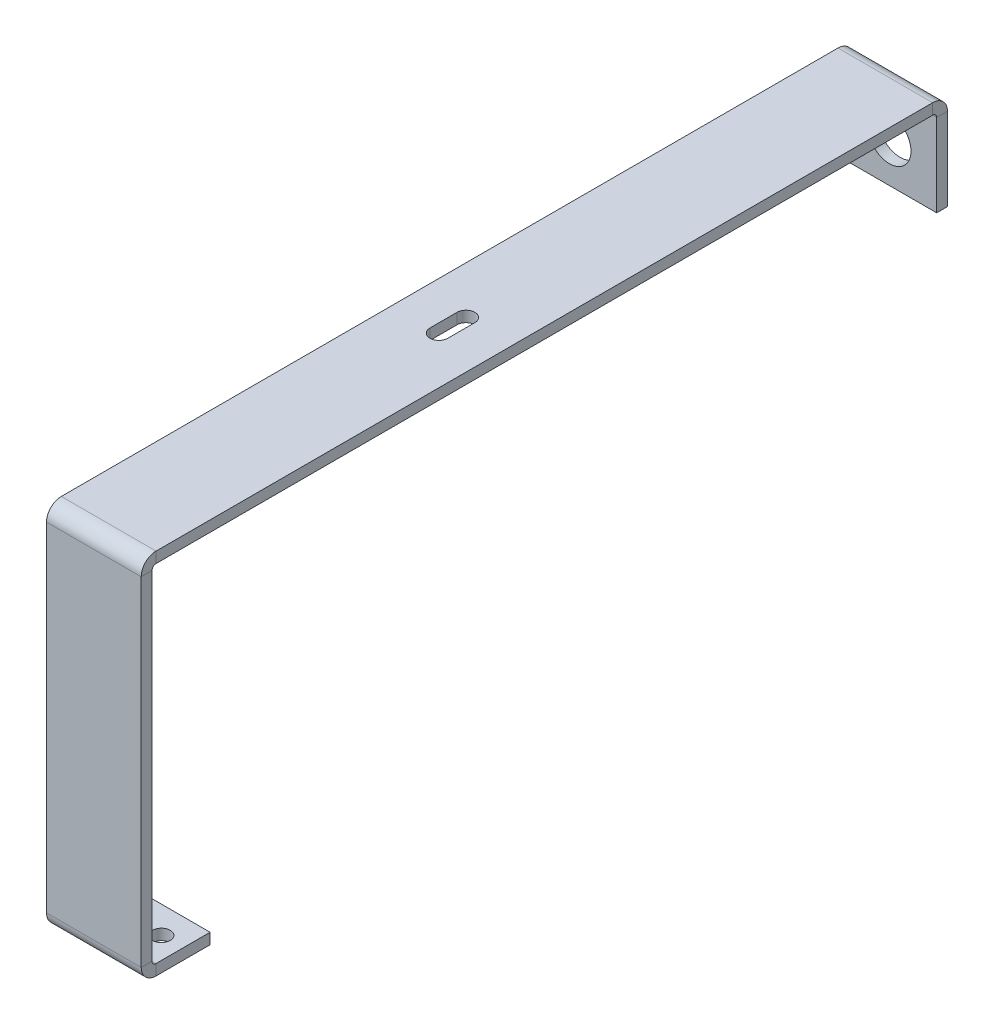
from build123d import *

# Parameters (mm, degrees)
SKETCH1_W                    = 17.5
SKETCH1_H                    = 10
BASE_FLANGE1_DEPTH           = 2
EDGE_FLANGE1_DEPTH           = 17.5
EDGE_FLANGE2_STRIP_W         = 9.4732
EDGE_FLANGE2_STRIP_H         = 2
EDGE_FLANGE2_STRIP_CUT_DEPTH = 17.5
EDGE_FLANGE2_DEPTH           = 17.5
EDGE_FLANGE3_STRIP_W         = 9.4732
EDGE_FLANGE3_STRIP_H         = 2
EDGE_FLANGE3_STRIP_CUT_DEPTH = 17.5
EDGE_FLANGE3_DEPTH           = 17.5
SKETCH18_R                   = 4
CUT_EXTRUDE2_DEPTH           = 2
F_4_CLEARANCE_HOLE1_D        = 3.2639
F_4_CLEARANCE_HOLE1_DEPTH    = 2
F_4_CLEARANCE_HOLE1_TIP      = 0.980574487
CUT_EXTRUDE3_DEPTH           = 2


# Sheet-metal steps are written as plain solids
with BuildPart() as part:
    # Sketch1 → Base-Flange1 (new body)
    with BuildSketch(Plane(origin=(0, 0, 0), x_dir=(1, 0, 0), z_dir=(0, 1, 0))):
        Rectangle(SKETCH1_W, SKETCH1_H)
    extrude(amount=BASE_FLANGE1_DEPTH)

    # Edge-Flange1 section (across the edge) → Edge-Flange1 (add)
    with BuildSketch(Plane(origin=(-8.75, 2, 5.7366), x_dir=(0, 0, -1), z_dir=(1, 0, 0))):
        with BuildLine():
            Line((-2, 0.7366), (-2, 66))
            Line((-2, 66), (0, 66))
            Line((0, 66), (0, 0.7366))
            ThreePointArc((0, 0.7366), (0.215745145, 0.215745145), (0.7366, 0))
            Line((0.7366, 0), (0.7366, -2))
            ThreePointArc((0.7366, -2), (-1.198468417, -1.198468417), (-2, 0.7366))
        make_face()
    extrude(amount=EDGE_FLANGE1_DEPTH)

    # Edge-Flange2 strip (across the edge) → Edge-Flange2 strip cut (cut)
    with BuildSketch(Plane(origin=(-8.75, 68, 5.7366), x_dir=(0, -1, 0), z_dir=(1, 0, 0))):
        with Locations((-2, -1)):
            Rectangle(EDGE_FLANGE2_STRIP_W, EDGE_FLANGE2_STRIP_H)
    extrude(amount=EDGE_FLANGE2_STRIP_CUT_DEPTH, mode=Mode.SUBTRACT)

    # Edge-Flange2 section (across the edge) → Edge-Flange2 (add)
    with BuildSketch(Plane(origin=(-8.75, 68, 5.7366), x_dir=(0, -1, 0), z_dir=(1, 0, 0))):
        with BuildLine():
            Line((0, 0.7366), (0, 147))
            Line((0, 147), (2, 147))
            Line((2, 147), (2, 0.7366))
            ThreePointArc((2, 0.7366), (2.215745145, 0.215745145), (2.7366, 0))
            Line((2.7366, 0), (2.7366, -2))
            ThreePointArc((2.7366, -2), (0.801531583, -1.198468417), (0, 0.7366))
        make_face()
    extrude(amount=EDGE_FLANGE2_DEPTH)

    # Edge-Flange3 strip (across the edge) → Edge-Flange3 strip cut (cut)
    with BuildSketch(Plane(origin=(-8.75, 66, -141.2634), x_dir=(0, 0, 1), z_dir=(1, 0, 0))):
        with Locations((-2, -1)):
            Rectangle(EDGE_FLANGE3_STRIP_W, EDGE_FLANGE3_STRIP_H)
    extrude(amount=EDGE_FLANGE3_STRIP_CUT_DEPTH, mode=Mode.SUBTRACT)

    # Edge-Flange3 section (across the edge) → Edge-Flange3 (add)
    with BuildSketch(Plane(origin=(-8.75, 66, -141.2634), x_dir=(0, 0, 1), z_dir=(1, 0, 0))):
        with BuildLine():
            Line((0, 0.7366), (0, 16))
            Line((0, 16), (2, 16))
            Line((2, 16), (2, 0.7366))
            ThreePointArc((2, 0.7366), (2.215745145, 0.215745145), (2.7366, 0))
            Line((2.7366, 0), (2.7366, -2))
            ThreePointArc((2.7366, -2), (0.801531583, -1.198468417), (0, 0.7366))
        make_face()
    extrude(amount=EDGE_FLANGE3_DEPTH)

    # Sketch18 → Cut-Extrude2 (cut)
    with BuildSketch(Plane(origin=(0, 0, -141.2634), x_dir=(-1, 0, 0), z_dir=(0, 0, -1))):
        with Locations(Location((0, 57.5, 0), (0, 0, 90))):
            Circle(SKETCH18_R)
    extrude(amount=-CUT_EXTRUDE2_DEPTH, mode=Mode.SUBTRACT)

    # #4 Clearance Hole1
    with Locations(Plane.XZ):
        with Locations((4.75, 0), (-4.75, 0)):
            Hole(F_4_CLEARANCE_HOLE1_D / 2, depth=F_4_CLEARANCE_HOLE1_DEPTH)
            with Locations((0, 0, -(F_4_CLEARANCE_HOLE1_DEPTH + F_4_CLEARANCE_HOLE1_TIP / 2))):  # 118° drill point
                Cone(0, F_4_CLEARANCE_HOLE1_D / 2, F_4_CLEARANCE_HOLE1_TIP, mode=Mode.SUBTRACT)

    # Sketch23 → Cut-Extrude3 (cut)
    with BuildSketch(Plane.XZ.offset(-66)):
        with BuildLine():
            Line((-1.65, -61.0268), (-1.65, -56.0268))
            ThreePointArc((-1.65, -56.0268), (0, -54.3768), (1.65, -56.0268))
            Line((1.65, -56.0268), (1.65, -61.0268))
            ThreePointArc((1.65, -61.0268), (0, -62.6768), (-1.65, -61.0268))
        make_face()
    extrude(amount=-CUT_EXTRUDE3_DEPTH, mode=Mode.SUBTRACT)


solid = part.part
